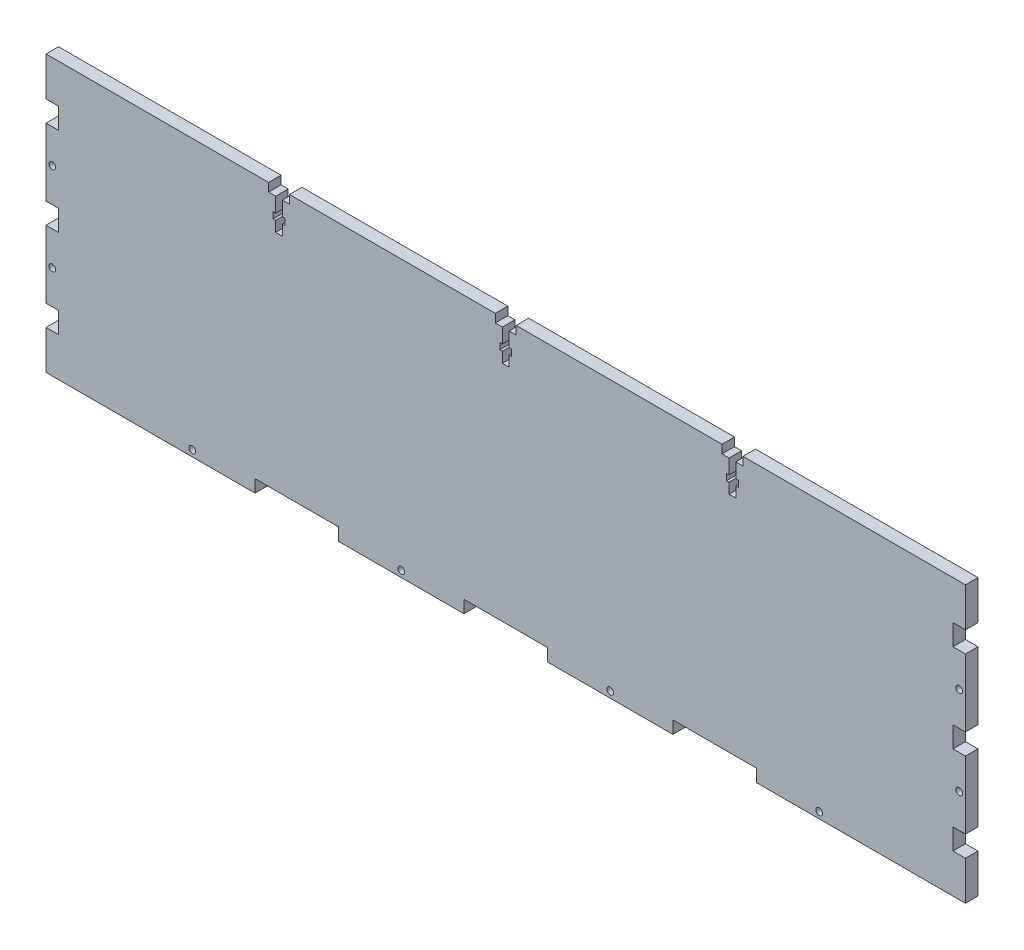
from build123d import *

# Parameters (mm, degrees)
SKETCH1_W           = 440
SKETCH1_H           = 132
BOSS_EXTRUDE1_DEPTH = 6
CUT_EXTRUDE1_REACH  = 231.765
SKETCH2_R           = 1.6
SKETCH2_W           = 6
SKETCH2_H           = 10
CUT_EXTRUDE2_REACH  = 231.765
SKETCH3_R           = 1.6
CUT_EXTRUDE3_REACH  = 231.765
SKETCH4_W           = 40
SKETCH4_H           = 6
SKETCH5_W           = 10
SKETCH5_H           = 6
CUT_EXTRUDE4_DEPTH  = 4
CUT_EXTRUDE5_REACH  = 231.765


with BuildPart() as part:
    # Sketch1 → Boss-Extrude1 (new body)
    with BuildSketch(Plane.XY):
        Rectangle(SKETCH1_W, SKETCH1_H)
    extrude(amount=BOSS_EXTRUDE1_DEPTH)

    # Sketch2 → Cut-Extrude1 (cut, up to next)
    with BuildSketch(Plane(origin=(0, 0, 0), x_dir=(-1, 0, 0), z_dir=(0, 0, -1)), mode=Mode.PRIVATE) as cut_extrude1_sk1:
        with Locations((217, 21.166064391)):
            Circle(SKETCH2_R)
    cut_extrude1_tool1 = extrude(cut_extrude1_sk1.sketch, amount=-CUT_EXTRUDE1_REACH, mode=Mode.PRIVATE) & part.part
    # Sketch2 → Cut-Extrude1 (cut, up to next)
    with BuildSketch(Plane(origin=(0, 0, 0), x_dir=(-1, 0, 0), z_dir=(0, 0, -1)), mode=Mode.PRIVATE) as cut_extrude1_sk2:
        with Locations((217, -21.166064391)):
            Circle(SKETCH2_R)
    cut_extrude1_tool2 = extrude(cut_extrude1_sk2.sketch, amount=-CUT_EXTRUDE1_REACH, mode=Mode.PRIVATE) & part.part
    # Sketch2 → Cut-Extrude1 (cut, up to next)
    with BuildSketch(Plane(origin=(0, 0, 0), x_dir=(-1, 0, 0), z_dir=(0, 0, -1)), mode=Mode.PRIVATE) as cut_extrude1_sk3:
        with Locations((-217, 21.166064391)):
            Circle(SKETCH2_R)
    cut_extrude1_tool3 = extrude(cut_extrude1_sk3.sketch, amount=-CUT_EXTRUDE1_REACH, mode=Mode.PRIVATE) & part.part
    # Sketch2 → Cut-Extrude1 (cut, up to next)
    with BuildSketch(Plane(origin=(0, 0, 0), x_dir=(-1, 0, 0), z_dir=(0, 0, -1)), mode=Mode.PRIVATE) as cut_extrude1_sk4:
        with Locations((-217, -21.166064391)):
            Circle(SKETCH2_R)
    cut_extrude1_tool4 = extrude(cut_extrude1_sk4.sketch, amount=-CUT_EXTRUDE1_REACH, mode=Mode.PRIVATE) & part.part
    # Sketch2 → Cut-Extrude1 (cut, up to next)
    with BuildSketch(Plane(origin=(0, 0, 0), x_dir=(-1, 0, 0), z_dir=(0, 0, -1)), mode=Mode.PRIVATE) as cut_extrude1_sk5:
        with Locations((217, 42.332128782)):
            Rectangle(SKETCH2_W, SKETCH2_H)
    cut_extrude1_tool5 = extrude(cut_extrude1_sk5.sketch, amount=-CUT_EXTRUDE1_REACH, mode=Mode.PRIVATE) & part.part
    # Sketch2 → Cut-Extrude1 (cut, up to next)
    with BuildSketch(Plane(origin=(0, 0, 0), x_dir=(-1, 0, 0), z_dir=(0, 0, -1)), mode=Mode.PRIVATE) as cut_extrude1_sk6:
        with Locations((217, -42.332128782)):
            Rectangle(SKETCH2_W, SKETCH2_H)
    cut_extrude1_tool6 = extrude(cut_extrude1_sk6.sketch, amount=-CUT_EXTRUDE1_REACH, mode=Mode.PRIVATE) & part.part
    # Sketch2 → Cut-Extrude1 (cut, up to next)
    with BuildSketch(Plane(origin=(0, 0, 0), x_dir=(-1, 0, 0), z_dir=(0, 0, -1)), mode=Mode.PRIVATE) as cut_extrude1_sk7:
        with Locations((-217, -42.332128782)):
            Rectangle(SKETCH2_W, SKETCH2_H)
    cut_extrude1_tool7 = extrude(cut_extrude1_sk7.sketch, amount=-CUT_EXTRUDE1_REACH, mode=Mode.PRIVATE) & part.part
    # Sketch2 → Cut-Extrude1 (cut, up to next)
    with BuildSketch(Plane(origin=(0, 0, 0), x_dir=(-1, 0, 0), z_dir=(0, 0, -1)), mode=Mode.PRIVATE) as cut_extrude1_sk8:
        with Locations((-217, 42.332128782)):
            Rectangle(SKETCH2_W, SKETCH2_H)
    cut_extrude1_tool8 = extrude(cut_extrude1_sk8.sketch, amount=-CUT_EXTRUDE1_REACH, mode=Mode.PRIVATE) & part.part
    # Sketch2 → Cut-Extrude1 (cut, up to next)
    with BuildSketch(Plane(origin=(0, 0, 0), x_dir=(-1, 0, 0), z_dir=(0, 0, -1)), mode=Mode.PRIVATE) as cut_extrude1_sk9:
        with Locations((217, 0)):
            Rectangle(SKETCH2_W, SKETCH2_H)
    cut_extrude1_tool9 = extrude(cut_extrude1_sk9.sketch, amount=-CUT_EXTRUDE1_REACH, mode=Mode.PRIVATE) & part.part
    # Sketch2 → Cut-Extrude1 (cut, up to next)
    with BuildSketch(Plane(origin=(0, 0, 0), x_dir=(-1, 0, 0), z_dir=(0, 0, -1)), mode=Mode.PRIVATE) as cut_extrude1_sk10:
        with Locations((-217, 0)):
            Rectangle(SKETCH2_W, SKETCH2_H)
    cut_extrude1_tool10 = extrude(cut_extrude1_sk10.sketch, amount=-CUT_EXTRUDE1_REACH, mode=Mode.PRIVATE) & part.part
    add(cut_extrude1_tool1.solids().sort_by_distance((-217, 21.166064, 0))[0], mode=Mode.SUBTRACT)
    add(cut_extrude1_tool2.solids().sort_by_distance((-217, -21.166064, 0))[0], mode=Mode.SUBTRACT)
    add(cut_extrude1_tool3.solids().sort_by_distance((217, 21.166064, 0))[0], mode=Mode.SUBTRACT)
    add(cut_extrude1_tool4.solids().sort_by_distance((217, -21.166064, 0))[0], mode=Mode.SUBTRACT)
    add(cut_extrude1_tool5.solids().sort_by_distance((-217, 42.332129, 0))[0], mode=Mode.SUBTRACT)
    add(cut_extrude1_tool6.solids().sort_by_distance((-217, -42.332129, 0))[0], mode=Mode.SUBTRACT)
    add(cut_extrude1_tool7.solids().sort_by_distance((217, -42.332129, 0))[0], mode=Mode.SUBTRACT)
    add(cut_extrude1_tool8.solids().sort_by_distance((217, 42.332129, 0))[0], mode=Mode.SUBTRACT)
    add(cut_extrude1_tool9.solids().sort_by_distance((-217, 0, 0))[0], mode=Mode.SUBTRACT)
    add(cut_extrude1_tool10.solids().sort_by_distance((217, 0, 0))[0], mode=Mode.SUBTRACT)

    # Sketch3 → Cut-Extrude2 (cut, up to next)
    with BuildSketch(Plane(origin=(0, 0, 0), x_dir=(-1, 0, 0), z_dir=(0, 0, -1)), mode=Mode.PRIVATE) as cut_extrude2_sk1:
        with Locations((-150, -63)):
            Circle(SKETCH3_R)
    cut_extrude2_tool1 = extrude(cut_extrude2_sk1.sketch, amount=-CUT_EXTRUDE2_REACH, mode=Mode.PRIVATE) & part.part
    # Sketch3 → Cut-Extrude2 (cut, up to next)
    with BuildSketch(Plane(origin=(0, 0, 0), x_dir=(-1, 0, 0), z_dir=(0, 0, -1)), mode=Mode.PRIVATE) as cut_extrude2_sk2:
        with Locations((-50, -63)):
            Circle(SKETCH3_R)
    cut_extrude2_tool2 = extrude(cut_extrude2_sk2.sketch, amount=-CUT_EXTRUDE2_REACH, mode=Mode.PRIVATE) & part.part
    # Sketch3 → Cut-Extrude2 (cut, up to next)
    with BuildSketch(Plane(origin=(0, 0, 0), x_dir=(-1, 0, 0), z_dir=(0, 0, -1)), mode=Mode.PRIVATE) as cut_extrude2_sk3:
        with Locations((50, -63)):
            Circle(SKETCH3_R)
    cut_extrude2_tool3 = extrude(cut_extrude2_sk3.sketch, amount=-CUT_EXTRUDE2_REACH, mode=Mode.PRIVATE) & part.part
    # Sketch3 → Cut-Extrude2 (cut, up to next)
    with BuildSketch(Plane(origin=(0, 0, 0), x_dir=(-1, 0, 0), z_dir=(0, 0, -1)), mode=Mode.PRIVATE) as cut_extrude2_sk4:
        with Locations((150, -63)):
            Circle(SKETCH3_R)
    cut_extrude2_tool4 = extrude(cut_extrude2_sk4.sketch, amount=-CUT_EXTRUDE2_REACH, mode=Mode.PRIVATE) & part.part
    add(cut_extrude2_tool1.solids().sort_by_distance((150, -63, 0))[0], mode=Mode.SUBTRACT)
    add(cut_extrude2_tool2.solids().sort_by_distance((50, -63, 0))[0], mode=Mode.SUBTRACT)
    add(cut_extrude2_tool3.solids().sort_by_distance((-50, -63, 0))[0], mode=Mode.SUBTRACT)
    add(cut_extrude2_tool4.solids().sort_by_distance((-150, -63, 0))[0], mode=Mode.SUBTRACT)

    # Sketch4 → Cut-Extrude3 (cut, up to next)
    with BuildSketch(Plane(origin=(0, 0, 0), x_dir=(-1, 0, 0), z_dir=(0, 0, -1)), mode=Mode.PRIVATE) as cut_extrude3_sk1:
        with Locations((100, -63)):
            Rectangle(SKETCH4_W, SKETCH4_H)
    cut_extrude3_tool1 = extrude(cut_extrude3_sk1.sketch, amount=-CUT_EXTRUDE3_REACH, mode=Mode.PRIVATE) & part.part
    # Sketch4 → Cut-Extrude3 (cut, up to next)
    with BuildSketch(Plane(origin=(0, 0, 0), x_dir=(-1, 0, 0), z_dir=(0, 0, -1)), mode=Mode.PRIVATE) as cut_extrude3_sk2:
        with Locations((0, -63)):
            Rectangle(SKETCH4_W, SKETCH4_H)
    cut_extrude3_tool2 = extrude(cut_extrude3_sk2.sketch, amount=-CUT_EXTRUDE3_REACH, mode=Mode.PRIVATE) & part.part
    # Sketch4 → Cut-Extrude3 (cut, up to next)
    with BuildSketch(Plane(origin=(0, 0, 0), x_dir=(-1, 0, 0), z_dir=(0, 0, -1)), mode=Mode.PRIVATE) as cut_extrude3_sk3:
        with Locations((-100, -63)):
            Rectangle(SKETCH4_W, SKETCH4_H)
    cut_extrude3_tool3 = extrude(cut_extrude3_sk3.sketch, amount=-CUT_EXTRUDE3_REACH, mode=Mode.PRIVATE) & part.part
    add(cut_extrude3_tool1.solids().sort_by_distance((-100, -63, 0))[0], mode=Mode.SUBTRACT)
    add(cut_extrude3_tool2.solids().sort_by_distance((0, -63, 0))[0], mode=Mode.SUBTRACT)
    add(cut_extrude3_tool3.solids().sort_by_distance((100, -63, 0))[0], mode=Mode.SUBTRACT)

    # Sketch5 → Cut-Extrude4 (cut)
    with BuildSketch(Plane(origin=(0, 66, 0), x_dir=(1, 0, 0), z_dir=(0, 1, 0))):
        with Locations((-108.5, -3)):
            Rectangle(SKETCH5_W, SKETCH5_H)
        with Locations((0, -3)):
            Rectangle(SKETCH5_W, SKETCH5_H)
        with Locations((108.5, -3)):
            Rectangle(SKETCH5_W, SKETCH5_H)
    extrude(amount=-CUT_EXTRUDE4_DEPTH, mode=Mode.SUBTRACT)

    # Sketch6 → Cut-Extrude5 (cut, up to next)
    with BuildSketch(Plane(origin=(0, 0, 0), x_dir=(-1, 0, 0), z_dir=(0, 0, -1)), mode=Mode.PRIVATE) as cut_extrude5_sk1:
        Polygon((-110.1, 62), (-110.1, 55), (-111.3, 55), (-111.3, 52), (-110.1, 52), (-110.1, 47), (-106.9, 47), (-106.9, 52), (-105.7, 52), (-105.7, 55), (-106.9, 55), (-106.9, 62), align=None)
    cut_extrude5_tool1 = extrude(cut_extrude5_sk1.sketch, amount=-CUT_EXTRUDE5_REACH, mode=Mode.PRIVATE) & part.part
    # Sketch6 → Cut-Extrude5 (cut, up to next)
    with BuildSketch(Plane(origin=(0, 0, 0), x_dir=(-1, 0, 0), z_dir=(0, 0, -1)), mode=Mode.PRIVATE) as cut_extrude5_sk2:
        Polygon((-1.6, 62), (-1.6, 55), (-2.8, 55), (-2.8, 52), (-1.6, 52), (-1.6, 47), (1.6, 47), (1.6, 52), (2.8, 52), (2.8, 55), (1.6, 55), (1.6, 62), align=None)
    cut_extrude5_tool2 = extrude(cut_extrude5_sk2.sketch, amount=-CUT_EXTRUDE5_REACH, mode=Mode.PRIVATE) & part.part
    # Sketch6 → Cut-Extrude5 (cut, up to next)
    with BuildSketch(Plane(origin=(0, 0, 0), x_dir=(-1, 0, 0), z_dir=(0, 0, -1)), mode=Mode.PRIVATE) as cut_extrude5_sk3:
        Polygon((106.9, 62), (106.9, 55), (105.7, 55), (105.7, 52), (106.9, 52), (106.9, 47), (110.1, 47), (110.1, 52), (111.3, 52), (111.3, 55), (110.1, 55), (110.1, 62), align=None)
    cut_extrude5_tool3 = extrude(cut_extrude5_sk3.sketch, amount=-CUT_EXTRUDE5_REACH, mode=Mode.PRIVATE) & part.part
    add(cut_extrude5_tool1.solids().sort_by_distance((108.5, 54.369565, 0))[0], mode=Mode.SUBTRACT)
    add(cut_extrude5_tool2.solids().sort_by_distance((0, 54.369565, 0))[0], mode=Mode.SUBTRACT)
    add(cut_extrude5_tool3.solids().sort_by_distance((-108.5, 54.369565, 0))[0], mode=Mode.SUBTRACT)


solid = part.part
